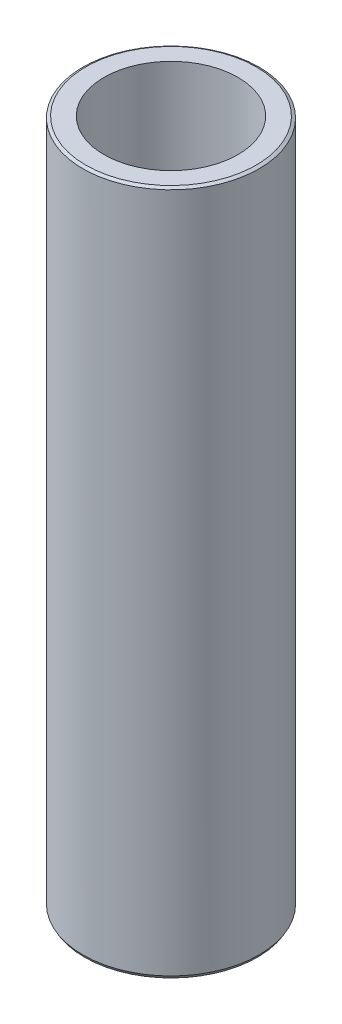
from build123d import *
from OCP.BRepFilletAPI import BRepFilletAPI_MakeChamfer

# Parameters (mm, degrees)
SKETCH1_R           = 55
BOSS_EXTRUDE1_DEPTH = 427.916587073
SKETCH2_R           = 41.818176783
CUT_EXTRUDE1_DEPTH  = 435.928276262
CHAMFER1_SIZE       = 1.049376466
CHAMFER1_SIZE2      = 1.817573355


with BuildPart() as part:
    # Sketch1 → Boss-Extrude1 (new body)
    with BuildSketch(Plane(origin=(0, 0, 0), x_dir=(1, 0, 0), z_dir=(0, 1, 0))):
        Circle(SKETCH1_R)
    extrude(amount=BOSS_EXTRUDE1_DEPTH)

    # Sketch2 → Cut-Extrude1 (cut, through all)
    with BuildSketch(Plane(origin=(0, 0, 0), x_dir=(1, 0, 0), z_dir=(0, 1, 0))):
        Circle(SKETCH2_R)
    extrude(amount=CUT_EXTRUDE1_DEPTH, mode=Mode.SUBTRACT)

    # Chamfer1: one chamfer whose edges measure the first distance from different faces: ONE call of the kernel's chamfer builder (chamfer() names one face for all edges)
    chamfer1_edges_1 = [part.edges().sort_by_distance(p)[0] for p in [
        (-55, 427.916587073, 0),
    ]]
    chamfer1_side_1 = [part.faces().sort_by_distance(p)[0] for p in [
        (-55, 213.958293537, 0),
    ]]
    chamfer1_edges_2 = [part.edges().sort_by_distance(p)[0] for p in [
        (-55, 0, 0),
    ]]
    chamfer1_side_2 = [part.faces().sort_by_distance(p)[0] for p in [
        (-53.444365081, 0, 0),
    ]]
    chamfer1 = BRepFilletAPI_MakeChamfer(part.part.solid().wrapped)
    for e in chamfer1_edges_1:
        chamfer1.Add(CHAMFER1_SIZE, CHAMFER1_SIZE2, e.wrapped, chamfer1_side_1[0].wrapped)  # the first distance lies on this face
    for e in chamfer1_edges_2:
        chamfer1.Add(CHAMFER1_SIZE, CHAMFER1_SIZE2, e.wrapped, chamfer1_side_2[0].wrapped)  # the first distance lies on this face
    add(Compound.cast(chamfer1.Shape()), mode=Mode.REPLACE)


solid = part.part
